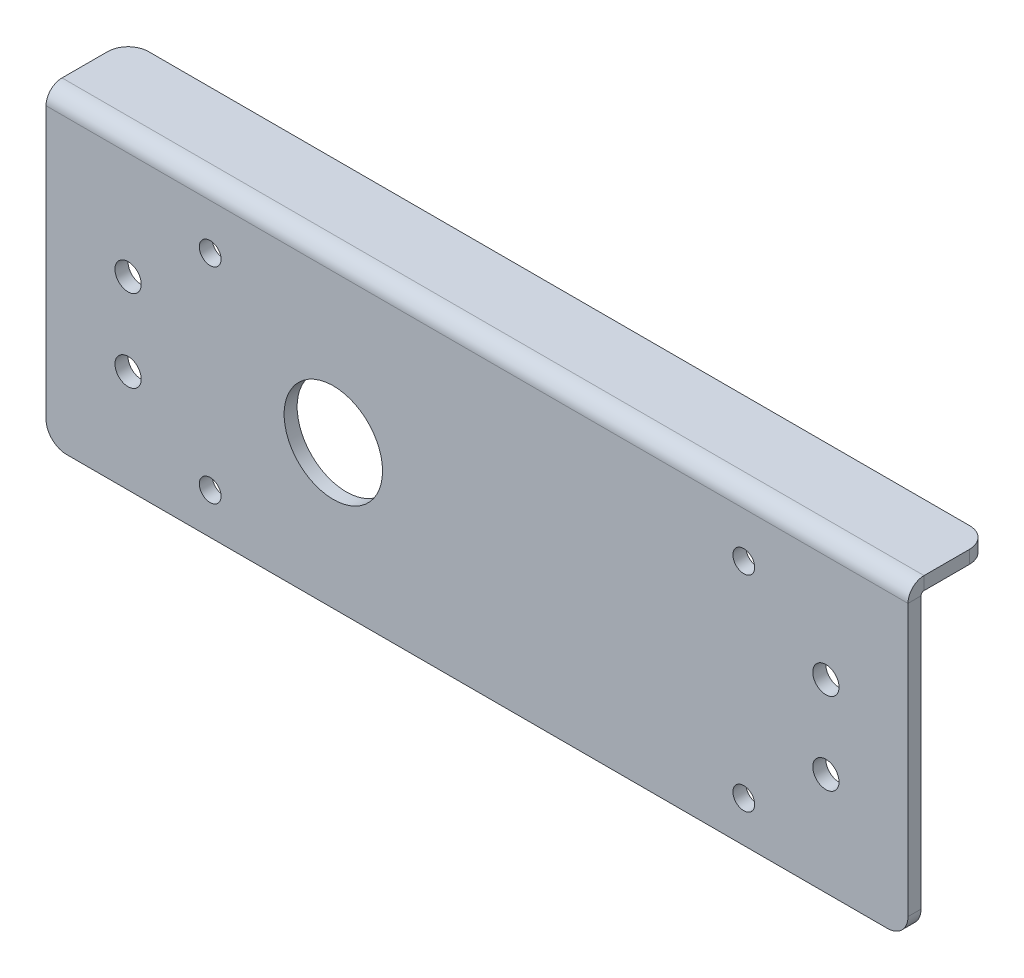
from build123d import *

# Parameters (mm, degrees)
SKETCH1_W                    = 210
SKETCH1_H                    = 75
SKETCH1_R                    = 11.9875
BASE_FLANGE1_DEPTH           = 3.175
EDGE_FLANGE1_STRIP_W         = 14.1732
EDGE_FLANGE1_STRIP_H         = 3.175
EDGE_FLANGE1_STRIP_CUT_DEPTH = 210
EDGE_FLANGE1_DEPTH           = 210
M6_CLEARANCE_HOLE2_D         = 6.4
M5_CLEARANCE_HOLE1_D         = 5.3
FILLET1_R                    = 5


# Sheet-metal steps are written as plain solids
with BuildPart() as part:
    # Sketch1 → Base-Flange1 (new body)
    with BuildSketch(Plane.XY):
        with Locations((35, 2.5)):
            Rectangle(SKETCH1_W, SKETCH1_H)
        Circle(SKETCH1_R, mode=Mode.SUBTRACT)
    extrude(amount=-BASE_FLANGE1_DEPTH)

    # Edge-Flange1 strip (across the edge) → Edge-Flange1 strip cut (cut)
    with BuildSketch(Plane(origin=(-70, 40, -3.175), x_dir=(0, -1, 0), z_dir=(1, 0, 0))):
        with Locations((-3.175, -1.5875)):
            Rectangle(EDGE_FLANGE1_STRIP_W, EDGE_FLANGE1_STRIP_H)
    extrude(amount=EDGE_FLANGE1_STRIP_CUT_DEPTH, mode=Mode.SUBTRACT)

    # Edge-Flange1 section (across the edge) → Edge-Flange1 (add)
    with BuildSketch(Plane(origin=(-70, 40, -3.175), x_dir=(0, -1, 0), z_dir=(1, 0, 0))):
        with BuildLine():
            Line((0, 0.7366), (0, 16.825))
            Line((0, 16.825), (3.175, 16.825))
            Line((3.175, 16.825), (3.175, 0.7366))
            ThreePointArc((3.175, 0.7366), (3.390745145, 0.215745145), (3.9116, 0))
            Line((3.9116, 0), (3.9116, -3.175))
            ThreePointArc((3.9116, -3.175), (1.145681115, -2.029318885), (0, 0.7366))
        make_face()
    extrude(amount=EDGE_FLANGE1_DEPTH)

    # M6 Clearance Hole2 (through all)
    with Locations(Plane(origin=(-50, 10, 0), x_dir=(1, 0, 0), z_dir=(0, 0, 1))):
        with Locations((0, 0), (0, -20), (170, -20), (170, 0)):
            Hole(M6_CLEARANCE_HOLE2_D / 2)

    # M5 Clearance Hole1 (through all)
    with Locations(Plane(origin=(-30, 25, 0), x_dir=(1, 0, 0), z_dir=(0, 0, 1))):
        with Locations((0, 0), (0, -50), (130, -50), (130, 0)):
            Hole(M5_CLEARANCE_HOLE1_D / 2)

    # Fillet1
    fillet1_edges = [part.edges().sort_by_distance(p)[0] for p in [
        (-70, 38.4125, -20),
        (140, 38.4125, -20),
        (140, -35, -1.5875),
        (-70, -35, -1.5875),
    ]]
    fillet(fillet1_edges, radius=FILLET1_R)


solid = part.part
